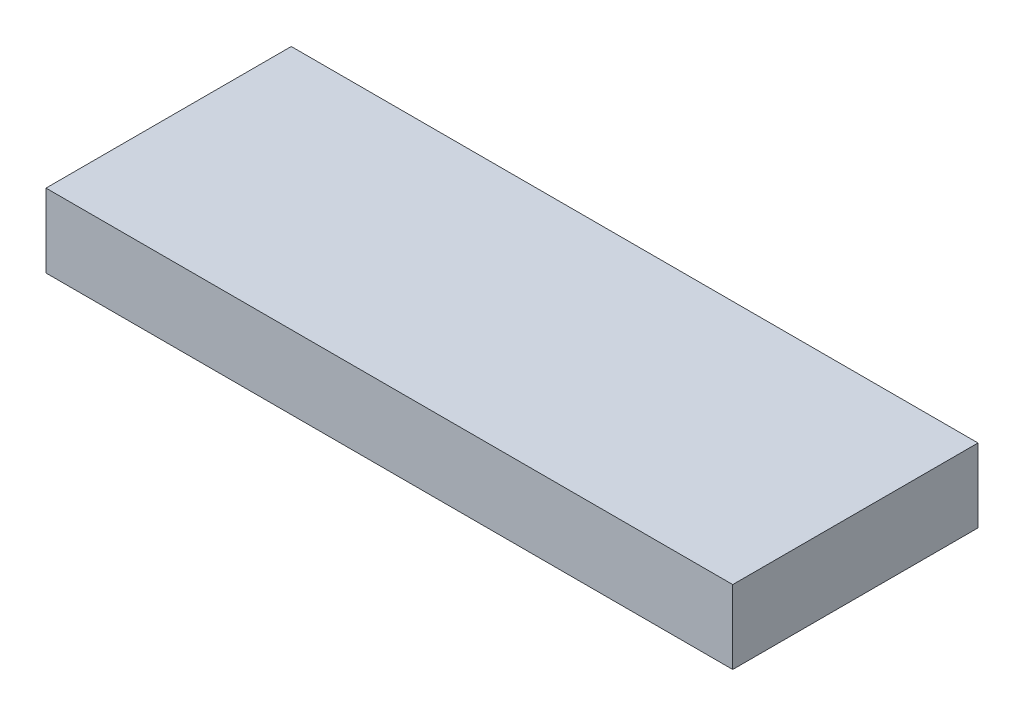
from build123d import *

# Parameters (mm, degrees)
SKETCH1_W           = 63.5
SKETCH1_H           = 19.05
BOSS_EXTRUDE1_DEPTH = 88.9


with BuildPart() as part:
    # Sketch1 → Boss-Extrude1 (new, symmetric)
    with BuildSketch(Plane(origin=(0, 0, 0), x_dir=(0, 0, -1), z_dir=(1, 0, 0))):
        Rectangle(SKETCH1_W, SKETCH1_H)
    extrude(amount=BOSS_EXTRUDE1_DEPTH, both=True)


solid = part.part
